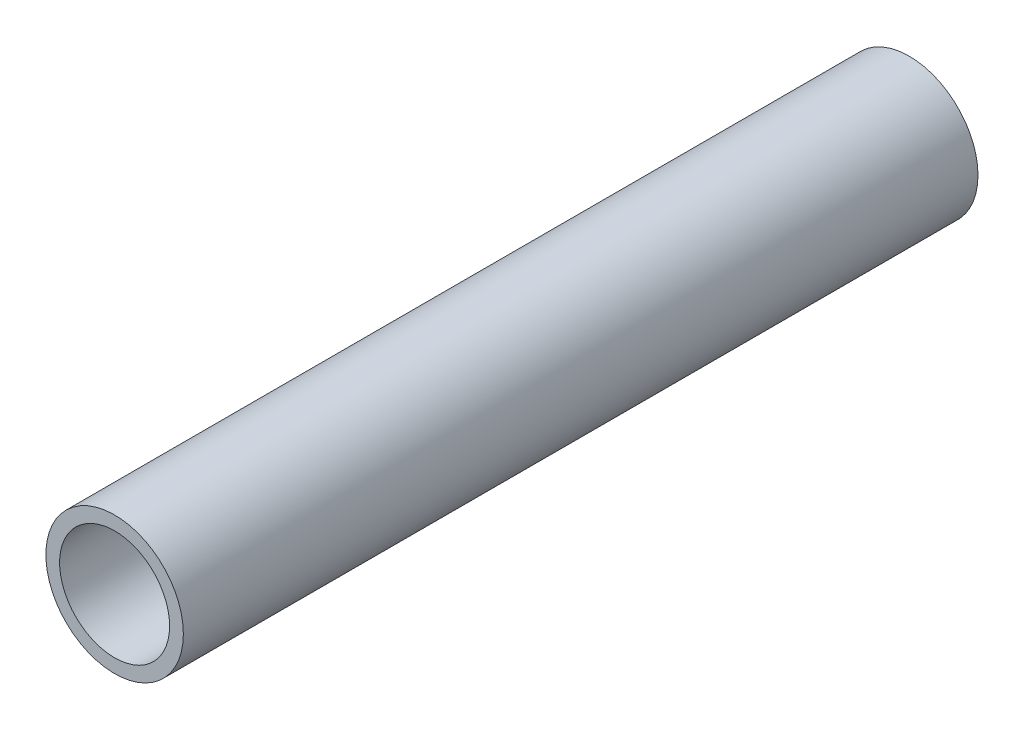
from build123d import *

# Parameters (mm, degrees)
SKETCH1_R           = 1.25
SKETCH1_R_2         = 1
BOSS_EXTRUDE1_DEPTH = 14.45


with BuildPart() as part:
    # Sketch1 → Boss-Extrude1 (new body)
    with BuildSketch(Plane.XY):
        Circle(SKETCH1_R)
        Circle(SKETCH1_R_2, mode=Mode.SUBTRACT)
    extrude(amount=BOSS_EXTRUDE1_DEPTH)


solid = part.part
